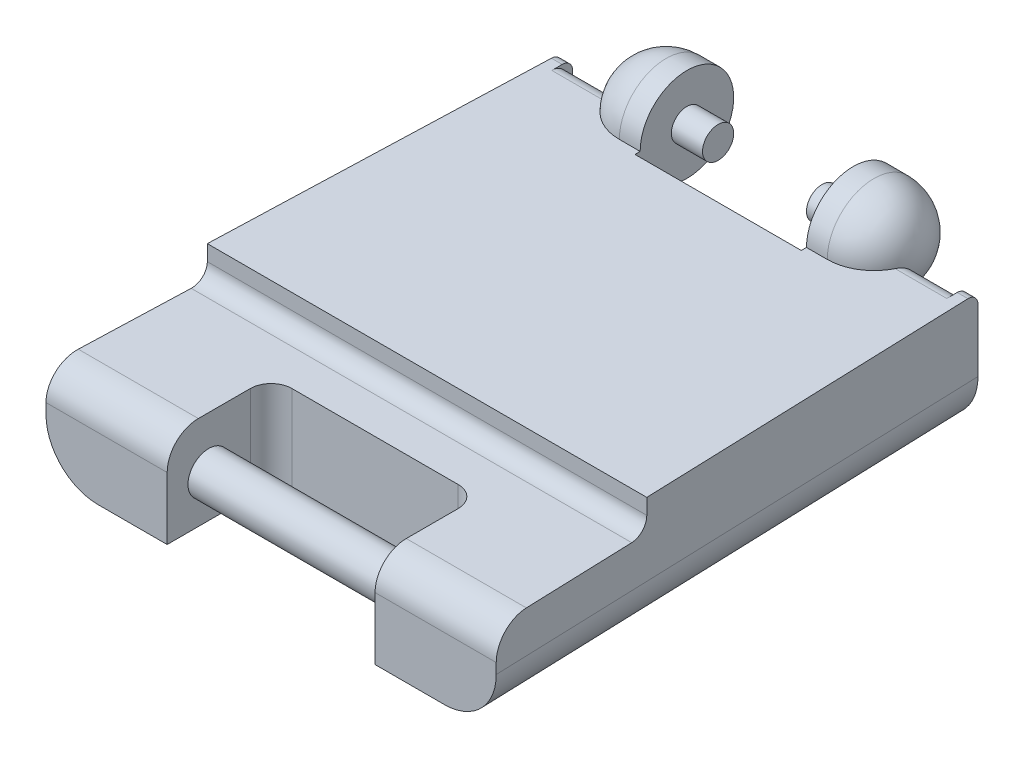
from build123d import *

# Parameters (mm, degrees)
SKETCH_1_W          = 58
SKETCH_1_H          = 12
EXTRUDE_1_DEPTH     = 22
CUT_EXTRUDE_2_DEPTH = 12
FILLET_2_R          = 5
CUT_EXTRUDE_3_DEPTH = 22
CUT_EXTRUDE_4_DEPTH = 0.5
FILLET_4_R          = 1.5
FILLET_5_R          = 1
SKETCH_6_R          = 5
CUT_EXTRUDE_5_DEPTH = 8
SKETCH_8_R          = 2
EXTRUDE_2_DEPTH     = 10
CUT_EXTRUDE_7_DEPTH = 0.5
SKETCH_10_R         = 5
EXTRUDE_3_DEPTH     = 1
SKETCH_11_R         = 4.5
EXTRUDE_4_DEPTH     = 1
SKETCH_12_R         = 3
CUT_EXTRUDE_8_DEPTH = 12
SKETCH_13_R         = 4
CUT_EXTRUDE_9_DEPTH = 2
SWEEP_3_PITCH       = 1


with BuildPart() as part:
    # Эскиз1 → Бобышка-Вытянуть1 (new, symmetric)
    with BuildSketch(Plane(origin=(0, 0, 0), x_dir=(0, 0, -1), z_dir=(1, 0, 0))):
        with Locations((-29, -6)):
            Rectangle(SKETCH_1_W, SKETCH_1_H)
    extrude(amount=EXTRUDE_1_DEPTH, both=True)

    # Эскиз3 → Вырез-Вытянуть2 (cut)
    with BuildSketch(Plane(origin=(0, 0, 0), x_dir=(1, 0, 0), z_dir=(0, 1, 0))):
        with BuildLine():
            Line((-20, 0), (-22, 0))
            Line((-22, 0), (-22, -58))
            Line((-22, -58), (22, -58))
            Line((22, -58), (22, 0))
            Line((22, 0), (20, 0))
            Line((20, 0), (21.655172414, -48))
            Line((21.655172414, -48), (10, -48))
            Line((10, -48), (10, -40))
            ThreePointArc((10, -40), (9.414213562, -38.585786438), (8, -38))
            Line((8, -38), (-8, -38))
            ThreePointArc((-8, -38), (-9.414213562, -38.585786438), (-10, -40))
            Line((-10, -40), (-10, -48))
            Line((-10, -48), (-21.655172414, -48))
            Line((-21.655172414, -48), (-20, 0))
        make_face()
    extrude(amount=-CUT_EXTRUDE_2_DEPTH, mode=Mode.SUBTRACT)

    # Скругление2
    fillet_2_edges = [part.edges().sort_by_distance(p)[0] for p in [
        (-20.827586207, -12, 24),
        (20.827586207, -12, 24),
    ]]
    fillet(fillet_2_edges, radius=FILLET_2_R)

    # Эскиз4 → Вырез-Вытянуть3 (cut, symmetric)
    with BuildSketch(Plane(origin=(0, 0, 0), x_dir=(0, 0, -1), z_dir=(1, 0, 0))):
        with BuildLine():
            Line((-33, 0), (-33, -1.5))
            ThreePointArc((-33, -1.5), (-33.439339828, -2.560660172), (-34.5, -3))
            Line((-34.5, -3), (-45, -3))
            ThreePointArc((-45, -3), (-47.121320344, -3.878679656), (-48, -6))
            Line((-48, -6), (-48, 0))
            Line((-48, 0), (-33, 0))
        make_face()
    extrude(amount=CUT_EXTRUDE_3_DEPTH, both=True, mode=Mode.SUBTRACT)

    # Эскиз5 → Вырез-Вытянуть4 (cut)
    with BuildSketch(Plane(origin=(0, 0, 0), x_dir=(-1, 0, 0), z_dir=(0, 0, -1))):
        with BuildLine():
            Line((19, 0), (-19, 0))
            Line((-19, 0), (-19, -7))
            add(Edge.make_bspline(
                [(-19, -7), (-19, -7.523520975), (-18.895847322, -8.046837701), (-18.494897371, -9.014241529), (-18.198254652, -9.457949319), (-17.457278985, -10.198484846), (-17.013235139, -10.495018762), (-16.044951376, -10.895856789), (-15.521093765, -11), (-14.997028232, -11)],
                knots=[0, 0, 0, 0, 0.25, 0.25, 0.5, 0.5, 0.75, 0.75, 1, 1, 1, 1], degree=3))
            Line((-14.997028232, -11), (14.997028232, -11))
            add(Edge.make_bspline(
                [(19, -7), (19, -7.523520975), (18.895847322, -8.046837701), (18.494897371, -9.014241529), (18.198254652, -9.457949319), (17.457278985, -10.198484846), (17.013235139, -10.495018762), (16.044951376, -10.895856789), (15.521093765, -11), (14.997028232, -11)],
                knots=[0, 0, 0, 0, 0.25, 0.25, 0.5, 0.5, 0.75, 0.75, 1, 1, 1, 1], degree=3))
            Line((19, -7), (19, 0))
        make_face()
    extrude(amount=-CUT_EXTRUDE_4_DEPTH, mode=Mode.SUBTRACT)

    # Скругление4
    fillet_4_edges = [part.edges().sort_by_distance(p)[0] for p in [
        (0, 0, 0.5),
    ]]
    fillet(fillet_4_edges, radius=FILLET_4_R)

    # Скругление5
    fillet_5_edges = [part.edges().sort_by_distance(p)[0] for p in [
        (-19.5, 0, 0),
        (19.5, 0, 0),
    ]]
    fillet(fillet_5_edges, radius=FILLET_5_R)

    # Эскиз6 → Вырез-Вытянуть5 (cut, symmetric)
    with BuildSketch(Plane(origin=(0, 0, 0), x_dir=(0, 0, -1), z_dir=(1, 0, 0))):
        Circle(SKETCH_6_R)
    extrude(amount=CUT_EXTRUDE_5_DEPTH, both=True, mode=Mode.SUBTRACT)

    # Эскиз7 → Повернуть1 (revolve)
    with BuildSketch(Plane(origin=(0, 0, 0), x_dir=(-1, 0, 0), z_dir=(0, 0, -1)), mode=Mode.PRIVATE) as revolve_1_sk:
        with BuildLine():
            Line((-14.5, 0), (-5, 0))
            Line((-5, 0), (-5, -1.5))
            Line((-5, -1.5), (-8, -1.5))
            Line((-8, -1.5), (-8, -4.5))
            Line((-8, -4.5), (-10, -4.5))
            ThreePointArc((-10, -4.5), (-13.181980515, -3.181980515), (-14.5, 0))
        make_face()
        with BuildLine():
            Line((8, -4.5), (10, -4.5))
            ThreePointArc((10, -4.5), (13.181980515, -3.181980515), (14.5, 0))
            Line((14.5, 0), (5, 0))
            Line((5, 0), (5, -1.5))
            Line((5, -1.5), (8, -1.5))
            Line((8, -1.5), (8, -4.5))
        make_face()
    revolve(revolve_1_sk.sketch.rotate(Axis((23.501869051, 0, 0), (-1, 0, 0)), 270), axis=Axis((23.501869051, 0, 0), (-1, 0, 0)))

    # Эскиз8 → Бобышка-Вытянуть2 (add, symmetric)
    with BuildSketch(Plane(origin=(0, 0, 0), x_dir=(0, 0, -1), z_dir=(1, 0, 0))):
        with Locations(Location((-44, -8, 0), (0, 0, 180))):
            Circle(SKETCH_8_R)
    extrude(amount=EXTRUDE_2_DEPTH, both=True)

    # Эскиз9 → Вырез-Вытянуть7 (cut)
    with BuildSketch(Plane.XZ.offset(12)):
        with BuildLine():
            Line((9.652497822, 2), (-9.652497822, 2))
            ThreePointArc((-9.652497822, 2), (-12.779168489, 3.263654755), (-14.149824819, 6.344919759))
            Line((-14.149824819, 6.344919759), (-14.942928268, 29.344919759))
            ThreePointArc((-14.942928268, 29.344919759), (-13.681946515, 32.626670667), (-10.44560127, 34))
            Line((-10.44560127, 34), (10.44560127, 34))
            ThreePointArc((10.44560127, 34), (13.681946515, 32.626670667), (14.942928268, 29.344919759))
            Line((14.942928268, 29.344919759), (14.149824819, 6.344919759))
            ThreePointArc((14.149824819, 6.344919759), (12.779168489, 3.263654755), (9.652497822, 2))
        make_face()
    extrude(amount=-CUT_EXTRUDE_7_DEPTH, mode=Mode.SUBTRACT)

    # Эскиз10 → Бобышка-Вытянуть3 (add)
    with BuildSketch(Plane.XZ.offset(11.5)):
        with BuildLine():
            Line((-9.652497822, 2.5), (9.652497822, 2.5))
            ThreePointArc((9.652497822, 2.5), (12.431760637, 3.623248671), (13.65012182, 6.362150897))
            Line((13.65012182, 6.362150897), (14.443225268, 29.362150897))
            ThreePointArc((14.443225268, 29.362150897), (13.322352599, 32.279262815), (10.44560127, 33.5))
            Line((10.44560127, 33.5), (-10.44560127, 33.5))
            ThreePointArc((-10.44560127, 33.5), (-13.322352599, 32.279262815), (-14.443225268, 29.362150897))
            Line((-14.443225268, 29.362150897), (-13.65012182, 6.362150897))
            ThreePointArc((-13.65012182, 6.362150897), (-12.431760637, 3.623248671), (-9.652497822, 2.5))
        make_face()
        with Locations(Location((0, 26, 0), (0, 0, 270))):
            Circle(SKETCH_10_R, mode=Mode.SUBTRACT)
    extrude(amount=EXTRUDE_3_DEPTH)

    # Эскиз11 → Бобышка-Вытянуть4 (add)
    with BuildSketch(Plane.XZ.offset(11.5)):
        with Locations(Location((0, 26, 0), (0, 0, 90))):
            Circle(SKETCH_11_R)
    extrude(amount=EXTRUDE_4_DEPTH)

    # Эскиз12 → Вырез-Вытянуть8 (cut)
    with BuildSketch(Plane.XZ.offset(12.5)):
        with Locations(Location((0, 26, 0), (0, 0, 270))):
            Circle(SKETCH_12_R)
    extrude(amount=-CUT_EXTRUDE_8_DEPTH, mode=Mode.SUBTRACT)

    # Эскиз13 → Вырез-Вытянуть9 (cut)
    with BuildSketch(Plane.XZ.offset(0.5)):
        with Locations(Location((0, 26, 0), (0, 0, 270))):
            Circle(SKETCH_13_R)
    extrude(amount=CUT_EXTRUDE_9_DEPTH, mode=Mode.SUBTRACT)

    # Вырез-По траектории3: arcs per turn and ends read off the stored shape
    # Вырез-По траектории3: the profile of Эскиз15 profile screwed along a right-hand helix through 11.5 turns, 8 arcs to a turn; built about Z, then put on its axis
    sweep_3_z = Axis((0, 0, 0), (0, 0, 1))
    sweep_3_corners = [(2.9997, 0, -1.450135), (4, 0, -1), (2.9997, 0, -0.549865)]
    with BuildLine(mode=Mode.PRIVATE) as sweep_3_profile:
        Line(sweep_3_corners[0], sweep_3_corners[1])
        Line(sweep_3_corners[1], sweep_3_corners[2])
        Line(sweep_3_corners[2], sweep_3_corners[0])
    sweep_3_cap = Face(sweep_3_profile.wire())
    sweep_3_turn_angles = [0, 22.5, 45, 67.5, 90, 112.5, 135, 157.5, 180, 202.5, 225, 247.5, 270, 292.5, 315, 337.5, 360]
    sweep_3_turn_weights = [1, 0.9238795325112867, 1, 0.9238795325112867, 1, 0.9238795325112867, 1, 0.9238795325112867, 1, 0.9238795325112867, 1, 0.9238795325112867, 1, 0.9238795325112867, 1, 0.9238795325112867, 1]
    sweep_3_turn_rails = [Edge.make_bspline([Vector(p[0], p[1], 0).rotate(sweep_3_z, sweep_3_turn_angles[k]) / sweep_3_turn_weights[k] + Vector(0, 0, p[2] + SWEEP_3_PITCH * sweep_3_turn_angles[k] / 360) for k in range(17)], [0, 0, 0, 1, 1, 2, 2, 3, 3, 4, 4, 5, 5, 6, 6, 7, 7, 8, 8, 8], 2, sweep_3_turn_weights) for p in sweep_3_corners]
    sweep_3_turn_sides = [Face.make_surface_from_curves(sweep_3_turn_rails[p[0]], sweep_3_turn_rails[p[1]]) for p in [(0, 1), (1, 2), (2, 0)]]
    sweep_3_last_angles = [3960, 3982.5, 4005, 4027.5, 4050, 4072.5, 4095, 4117.5, 4140]
    sweep_3_last_weights = [1, 0.9238795325112867, 1, 0.9238795325112867, 1, 0.9238795325112867, 1, 0.9238795325112867, 1]
    sweep_3_last_rails = [Edge.make_bspline([Vector(p[0], p[1], 0).rotate(sweep_3_z, sweep_3_last_angles[k]) / sweep_3_last_weights[k] + Vector(0, 0, p[2] + SWEEP_3_PITCH * sweep_3_last_angles[k] / 360) for k in range(9)], [0, 0, 0, 1, 1, 2, 2, 3, 3, 4, 4, 4], 2, sweep_3_last_weights) for p in sweep_3_corners]
    sweep_3_last_sides = [Face.make_surface_from_curves(sweep_3_last_rails[p[0]], sweep_3_last_rails[p[1]]) for p in [(0, 1), (1, 2), (2, 0)]]
    sweep_3 = Plane(origin=(0, -12.5, 26), x_dir=(-1, 0, 0), z_dir=(0, 1, 0)) * Solid(Shell([*[p.moved(Location((0, 0, SWEEP_3_PITCH * i))) for i in range(11) for p in sweep_3_turn_sides], *sweep_3_last_sides, sweep_3_cap, sweep_3_cap.rotate(sweep_3_z, 4140).moved(Location((0, 0, SWEEP_3_PITCH * 4140 / 360)))]))
    add(sweep_3, mode=Mode.SUBTRACT)


solid = part.part
